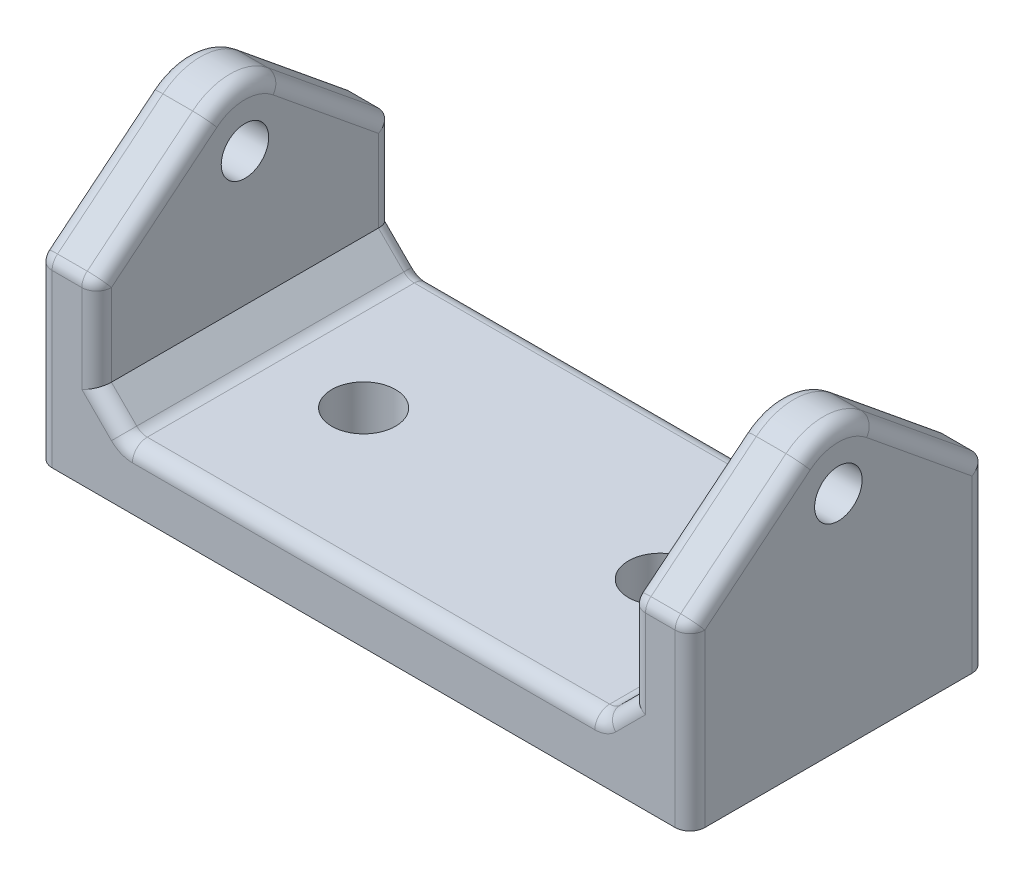
from build123d import *

# Parameters (mm, degrees)
SKETCH1_R           = 1.6
BOSS_EXTRUDE1_DEPTH = 44
SKETCH2_W           = 36
SKETCH2_H           = 15
CUT_EXTRUDE1_DEPTH  = 51.049975025
CHAMFER1_SIZE       = 2
FILLET1_R           = 1
SKETCH3_R           = 2.15
CUT_EXTRUDE2_DEPTH  = 48.549973743


with BuildPart() as part:
    # Sketch1 → Boss-Extrude1 (new body)
    with BuildSketch(Plane(origin=(0, 0, 0), x_dir=(0, 0, -1), z_dir=(1, 0, 0))):
        with BuildLine():
            Line((10, -6), (10, 6))
            Line((10, 6), (2.529576231, 12.098587435))
            ThreePointArc((2.529576231, 12.098587435), (0, 13), (-2.529576231, 12.098587435))
            Line((-2.529576231, 12.098587435), (-10, 6))
            Line((-10, 6), (-10, -6))
            Line((-10, -6), (10, -6))
        make_face()
        with Locations((0, 9)):
            Circle(SKETCH1_R, mode=Mode.SUBTRACT)
    extrude(amount=BOSS_EXTRUDE1_DEPTH)

    # Sketch2 → Cut-Extrude1 (cut, through all)
    with BuildSketch(Plane.XY.offset(10)):
        with Locations((22, 5.5)):
            Rectangle(SKETCH2_W, SKETCH2_H)
    extrude(amount=-CUT_EXTRUDE1_DEPTH, mode=Mode.SUBTRACT)

    # Chamfer1
    chamfer1_edges = [part.edges().sort_by_distance(p)[0] for p in [
        (40, -2, 0),
        (4, -2, 0),
    ]]
    chamfer(chamfer1_edges, length=CHAMFER1_SIZE)

    # Fillet1
    fillet1_edges = [part.edges().sort_by_distance(p)[0] for p in [
        (40, 3, -10),
        (40, 3, 10),
        (4, 3, -10),
        (4, 3, 10),
        (0, 0, -10),
        (44, 0, -10),
        (44, 0, 10),
        (0, 0, 10),
        (44, 9.049293718, -6.264788115),
        (44, 13, 0),
        (40, 9.049293718, -6.264788115),
        (40, 13, 0),
        (0, 9.049293718, -6.264788115),
        (0, 13, 0),
        (4, 9.049293718, -6.264788115),
        (4, 13, 0),
        (44, 9.049293718, 6.264788115),
        (42, 6, 10),
        (40, 9.049293718, 6.264788115),
        (2, 6, 10),
        (0, 9.049293718, 6.264788115),
        (4, 9.049293718, 6.264788115),
        (5, -1, -10),
        (5, -1, 10),
        (39, -1, -10),
        (39, -1, 10),
        (6, -2, 0),
        (22, -2, -10),
        (38, -2, 0),
        (22, -2, 10),
    ]]
    fillet(fillet1_edges, radius=FILLET1_R)

    # Sketch3 → Cut-Extrude2 (cut, through all)
    with BuildSketch(Plane(origin=(0, -2, 0), x_dir=(1, 0, 0), z_dir=(0, 1, 0))):
        with Locations((32, 0)):
            Circle(SKETCH3_R)
        with Locations((12, 0)):
            Circle(SKETCH3_R)
    extrude(amount=-CUT_EXTRUDE2_DEPTH, mode=Mode.SUBTRACT)


solid = part.part
